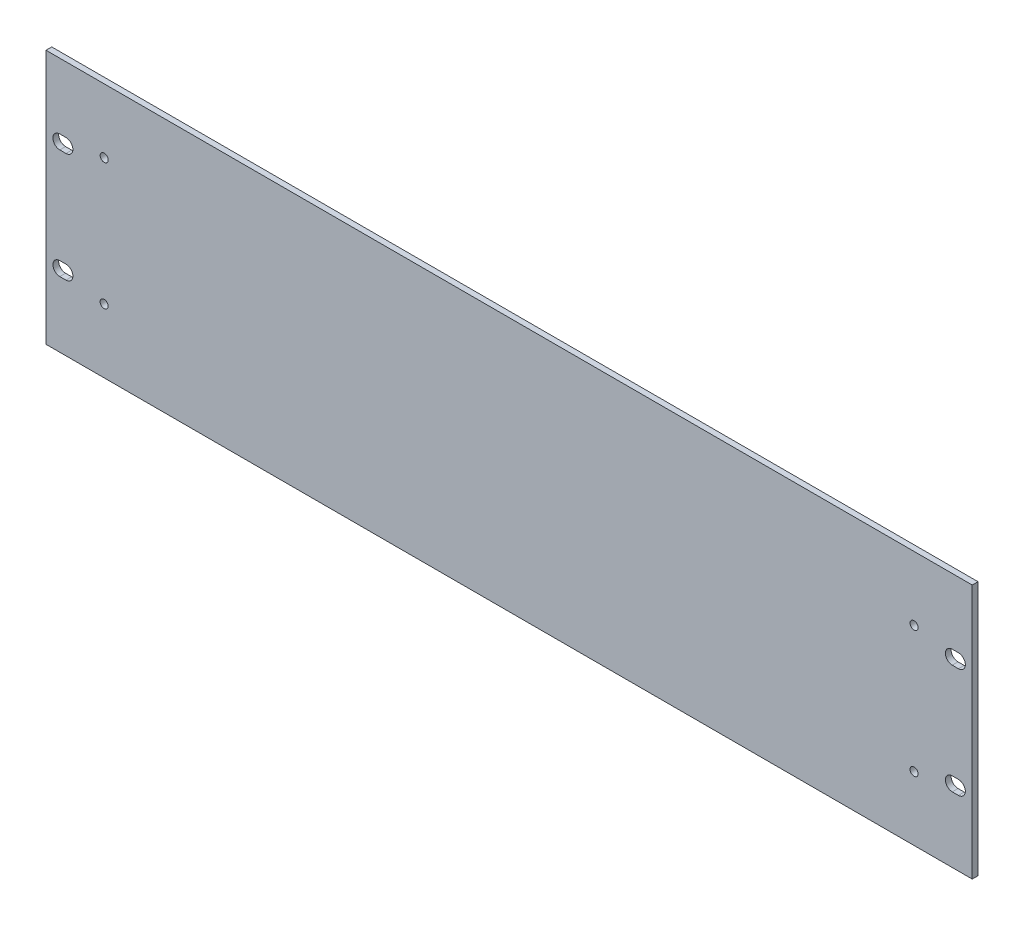
from build123d import *

# Parameters (mm, degrees)
SKETCH1_W          = 241.3
SKETCH1_H          = 66.35
SKETCH1_R          = 2.1
BASE_FLANGE1_DEPTH = 3


# Sheet-metal steps are written as plain solids
with BuildPart() as part:
    # Sketch1 → Base-Flange1 (new body)
    with BuildSketch(Plane.XY):
        with Locations((120.65, 33.175)):
            Rectangle(SKETCH1_W, SKETCH1_H)
        with Locations((211, 33)):
            Circle(SKETCH1_R, mode=Mode.SUBTRACT)
        with BuildLine():
            Line((230.9, 32.175), (234.1, 32.175))
            ThreePointArc((234.1, 32.175), (237.7, 28.575), (234.1, 24.975))
            Line((234.1, 24.975), (230.9, 24.975))
            ThreePointArc((230.9, 24.975), (227.3, 28.575), (230.9, 32.175))
        make_face(mode=Mode.SUBTRACT)
    extrude(amount=BASE_FLANGE1_DEPTH)

    # Mirror1: part across plane


with BuildPart() as part_1:
    add(part.part)
    add(part.part.mirror(Plane(origin=(0, 0, 3), x_dir=(0, 0, 1), z_dir=(0, 1, 0))))

    # Mirror2: part across face


with BuildPart() as part_2:
    add(part_1.part)
    add(part_1.part.mirror(Plane(origin=(0, 0, 1.5), x_dir=(0, 0, 1), z_dir=(-1, 0, 0))))


solid = part_2.part
